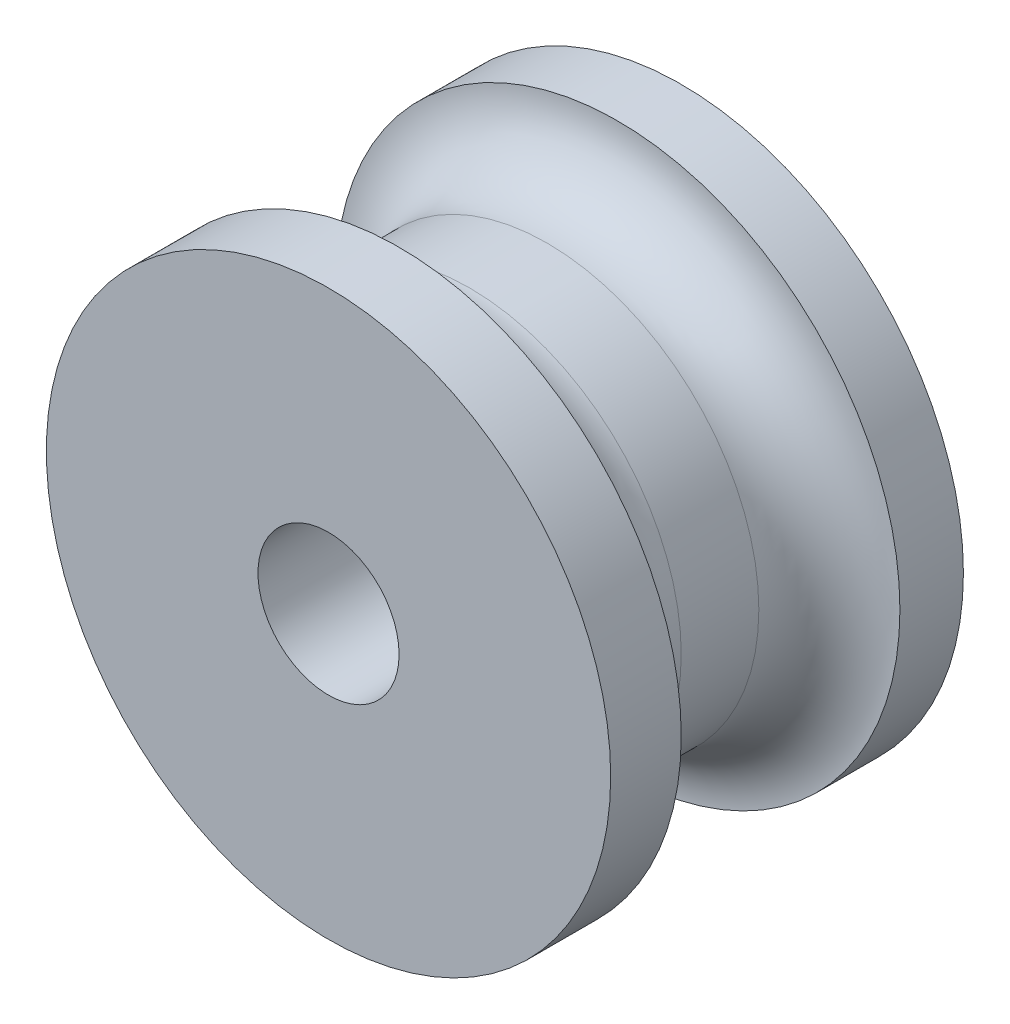
from build123d import *

# Parameters (mm, degrees)
SKETCH_1_R               = 40
EXTRUDE_1_DEPTH          = 50
CUT_EXTRUDE_1_DEPTH      = 15
CUT_EXTRUDE_1_DEPTH_BACK = 16
SKETCH_2_OUTSIDE_W       = 106.738
SKETCH_2_OUTSIDE_H       = 106.738
SKETCH_2_OUTSIDE_R       = 30
FILLET_1_R               = 10
FILLET_2_R               = 10
CUT_EXTRUDE_2_DEPTH      = 62.846584384
CUT_EXTRUDE_2_DEPTH_BACK = 62.846584384
SKETCH_3_R               = 10


with BuildPart() as part:
    # 草图1 → 凸台-拉伸1 (new body)
    with BuildSketch(Plane.XY):
        Circle(SKETCH_1_R)
    extrude(amount=EXTRUDE_1_DEPTH)

    # 草图2 outside → 切除-拉伸1 (cut, two sides: drawn at the far end of the back side and taken through both)
    with BuildSketch(Plane.XY.offset(25).offset(-CUT_EXTRUDE_1_DEPTH_BACK)):
        Rectangle(SKETCH_2_OUTSIDE_W, SKETCH_2_OUTSIDE_H)
        Circle(SKETCH_2_OUTSIDE_R, mode=Mode.SUBTRACT)
    extrude(amount=CUT_EXTRUDE_1_DEPTH + CUT_EXTRUDE_1_DEPTH_BACK, mode=Mode.SUBTRACT)

    # 圆角1
    fillet_1_edges = [part.edges().sort_by_distance(p)[0] for p in [
        (-30, 0, 40),
    ]]
    fillet(fillet_1_edges, radius=FILLET_1_R - 0.0001)  # a hair under: the kernel refuses the full size

    # 圆角2
    fillet_2_edges = [part.edges().sort_by_distance(p)[0] for p in [
        (-30, 0, 9),
    ]]
    fillet(fillet_2_edges, radius=FILLET_2_R - 0.0001)  # a hair under: the kernel refuses the full size

    # 草图3 → 切除-拉伸2 (cut, two sides: drawn at the far end of the back side and taken through both)
    with BuildSketch(Plane.XY.offset(25).offset(-CUT_EXTRUDE_2_DEPTH_BACK)):
        Circle(SKETCH_3_R)
    extrude(amount=CUT_EXTRUDE_2_DEPTH + CUT_EXTRUDE_2_DEPTH_BACK, mode=Mode.SUBTRACT)


solid = part.part
